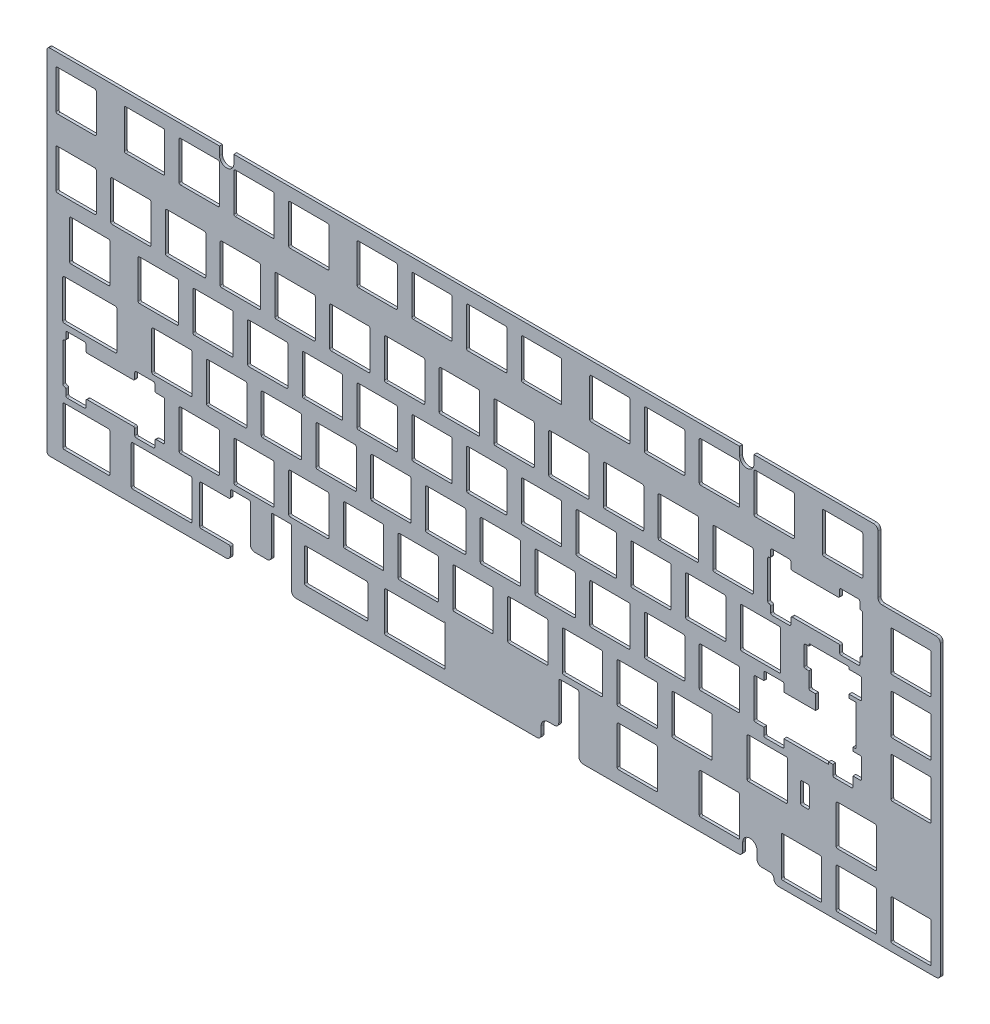
from build123d import *

# Parameters (mm, degrees)
BOSS_EXTRUDE1_DEPTH = 1
CUT_EXTRUDE2_DEPTH  = 1.3
CUT_EXTRUDE1_DEPTH  = 10


with BuildPart() as part:
    # Model → Boss-Extrude1 (new body)
    with BuildSketch(Plane.XY):
        with BuildLine():
            ThreePointArc((9.955298424, 130.969514546), (9.177480965, 130.647332005), (8.855298424, 129.869514546))
            Line((8.855298424, 129.869514546), (8.855298424, 63.082014546))
            Line((8.855298424, 63.082014546), (8.855298424, 9.057014546))
            ThreePointArc((8.855298424, 9.057014546), (9.177480965, 8.279197086), (9.955298424, 7.957014546))
            Line((9.955298424, 7.957014546), (71.206983424, 7.957014546))
            ThreePointArc((71.206983424, 7.957014546), (72.267643596, 8.396354374), (72.706983424, 9.457014546))
            Line((72.706983424, 9.457014546), (72.706983424, 11.957014546))
            ThreePointArc((72.706983424, 11.957014546), (72.560536815, 12.310567936), (72.206983424, 12.457014546))
            Line((72.206983424, 12.457014546), (62.559375038, 12.457014546))
            ThreePointArc((62.559375038, 12.457014546), (62.205821647, 12.603461155), (62.059375038, 12.957014546))
            Line((62.059375038, 12.957014546), (62.059375038, 25.957014546))
            ThreePointArc((62.059375038, 25.957014546), (62.205821647, 26.310567936), (62.559375038, 26.457014546))
            Line((62.559375038, 26.457014546), (72.206983424, 26.457014546))
            ThreePointArc((72.206983424, 26.457014546), (72.560536815, 26.603461155), (72.706983424, 26.957014546))
            Line((72.706983424, 26.957014546), (72.706983424, 28.958014546))
            ThreePointArc((72.706983424, 28.958014546), (72.853430033, 29.311567936), (73.206983424, 29.458014546))
            Line((73.206983424, 29.458014546), (79.206983424, 29.458014546))
            ThreePointArc((79.206983424, 29.458014546), (79.560536815, 29.311567936), (79.706983424, 28.958014546))
            Line((79.706983424, 28.958014546), (79.706983424, 16.157014546))
            ThreePointArc((79.706983424, 16.157014546), (80.146323252, 15.096354374), (81.206983424, 14.657014546))
            Line((81.206983424, 14.657014546), (85.495873424, 14.657014546))
            ThreePointArc((85.495873424, 14.657014546), (86.556533596, 15.096354374), (86.995873424, 16.157014546))
            Line((86.995873424, 16.157014546), (86.995873424, 28.958014546))
            ThreePointArc((86.995873424, 28.958014546), (87.142320033, 29.311567936), (87.495873424, 29.458014546))
            Line((87.495873424, 29.458014546), (93.495873424, 29.458014546))
            ThreePointArc((93.495873424, 29.458014546), (93.849426815, 29.311567936), (93.995873424, 28.958014546))
            Line((93.995873424, 28.958014546), (93.995873424, 9.457014546))
            ThreePointArc((93.995873424, 9.457014546), (94.435213252, 8.396354374), (95.495873424, 7.957014546))
            Line((95.495873424, 7.957014546), (179.362538424, 7.957014546))
            ThreePointArc((179.362538424, 7.957014546), (180.423198596, 8.396354374), (180.862538424, 9.457014546))
            Line((180.862538424, 9.457014546), (180.862538424, 12.157014546))
            ThreePointArc((180.862538424, 12.157014546), (181.594771471, 13.924781498), (183.362538424, 14.657014546))
            Line((183.362538424, 14.657014546), (185.495872282, 14.657014546))
            ThreePointArc((185.495872282, 14.657014546), (186.556532454, 15.096354374), (186.995872282, 16.157014546))
            Line((186.995872282, 16.157014546), (186.995872282, 28.958013975))
            ThreePointArc((186.995872282, 28.958013975), (187.14231869, 29.311567734), (187.495872282, 29.458014546))
            Line((187.495872282, 29.458014546), (193.495873424, 29.458014546))
            ThreePointArc((193.495873424, 29.458014546), (193.849426815, 29.311567936), (193.995873424, 28.958014546))
            Line((193.995873424, 28.958014546), (193.995873424, 9.457014546))
            ThreePointArc((193.995873424, 9.457014546), (194.435213252, 8.396354374), (195.495873424, 7.957014546))
            Line((195.495873424, 7.957014546), (249.492798424, 7.957014546))
            ThreePointArc((249.492798424, 7.957014546), (250.553458596, 8.396354374), (250.992798424, 9.457014546))
            Line((250.992798424, 9.457014546), (250.992798424, 12.157014546))
            ThreePointArc((250.992798424, 12.157014546), (253.492798424, 14.657014546), (255.992798424, 12.157014546))
            Line((255.992798424, 12.157014546), (255.992798424, 9.457014546))
            ThreePointArc((255.992798424, 9.457014546), (256.432138252, 8.396354374), (257.492798424, 7.957014546))
            Line((257.492798424, 7.957014546), (260.370951122, 7.957014546))
            ThreePointArc((260.370951122, 7.957014546), (261.407019411, 7.541709203), (261.869374773, 6.525764546))
            ThreePointArc((261.869374773, 6.525764546), (262.331730135, 5.509819888), (263.367798424, 5.094514546))
            Line((263.367798424, 5.094514546), (318.267798424, 5.094514546))
            ThreePointArc((318.267798424, 5.094514546), (319.328458596, 5.533854374), (319.767798424, 6.594514546))
            Line((319.767798424, 6.594514546), (319.767798424, 63.082014546))
            Line((319.767798424, 63.082014546), (319.767798424, 106.45317864))
            ThreePointArc((319.767798424, 106.45317864), (319.328458596, 107.513838812), (318.267798424, 107.95317864))
            Line((318.267798424, 107.95317864), (299.555298424, 107.95317864))
            ThreePointArc((299.555298424, 107.95317864), (298.494638252, 108.392518468), (298.055298424, 109.45317864))
            Line((298.055298424, 109.45317864), (298.055298424, 129.469514546))
            ThreePointArc((298.055298424, 129.469514546), (297.615958596, 130.530174717), (296.555298424, 130.969514546))
            Line((296.555298424, 130.969514546), (256.426800065, 130.969514546))
            Line((256.426800065, 130.969514546), (248.426800065, 130.969514546))
            Line((248.426800065, 130.969514546), (75.451800065, 130.969514546))
            Line((75.451800065, 130.969514546), (67.451800065, 130.969514546))
            Line((67.451800065, 130.969514546), (9.955298424, 130.969514546))
        make_face()
        with BuildLine():
            ThreePointArc((14.934285038, 12.457014546), (14.580731647, 12.603461155), (14.434285038, 12.957014546))
            Line((14.434285038, 12.957014546), (14.434285038, 25.957014546))
            ThreePointArc((14.434285038, 25.957014546), (14.580731647, 26.310567936), (14.934285038, 26.457014546))
            Line((14.934285038, 26.457014546), (30.319483424, 26.457014546))
            ThreePointArc((30.319483424, 26.457014546), (30.673036815, 26.310567936), (30.819483424, 25.957014546))
            Line((30.819483424, 25.957014546), (30.819483424, 12.957014546))
            ThreePointArc((30.819483424, 12.957014546), (30.673036815, 12.603461155), (30.319483424, 12.457014546))
            Line((30.319483424, 12.457014546), (14.934285038, 12.457014546))
        make_face(mode=Mode.SUBTRACT)
        with BuildLine():
            ThreePointArc((38.745375038, 12.457014546), (38.391821647, 12.603461155), (38.245375038, 12.957014546))
            Line((38.245375038, 12.957014546), (38.245375038, 25.957014546))
            ThreePointArc((38.245375038, 25.957014546), (38.391821647, 26.310567936), (38.745375038, 26.457014546))
            Line((38.745375038, 26.457014546), (58.894483424, 26.457014546))
            ThreePointArc((58.894483424, 26.457014546), (59.248036815, 26.310567936), (59.394483424, 25.957014546))
            Line((59.394483424, 25.957014546), (59.394483424, 12.957014546))
            ThreePointArc((59.394483424, 12.957014546), (59.248036815, 12.603461155), (58.894483424, 12.457014546))
            Line((58.894483424, 12.457014546), (38.745375038, 12.457014546))
        make_face(mode=Mode.SUBTRACT)
        with BuildLine():
            Line((120.541283424, 24.957014546), (120.541283424, 13.957014546))
            ThreePointArc((120.541283424, 13.957014546), (120.394836815, 13.603461155), (120.041283424, 13.457014546))
            Line((120.041283424, 13.457014546), (99.041283424, 13.457014546))
            ThreePointArc((99.041283424, 13.457014546), (98.687730033, 13.603461155), (98.541283424, 13.957014546))
            Line((98.541283424, 13.957014546), (98.541283424, 24.957014546))
            ThreePointArc((98.541283424, 24.957014546), (98.687730033, 25.310567936), (99.041283424, 25.457014546))
            Line((99.041283424, 25.457014546), (120.041283424, 25.457014546))
            ThreePointArc((120.041283424, 25.457014546), (120.394836815, 25.310567936), (120.541283424, 24.957014546))
        make_face(mode=Mode.SUBTRACT)
        with BuildLine():
            ThreePointArc((126.856983424, 12.457014546), (126.503430033, 12.603461155), (126.356983424, 12.957014546))
            Line((126.356983424, 12.957014546), (126.356983424, 25.957014546))
            ThreePointArc((126.356983424, 25.957014546), (126.503430033, 26.310567936), (126.856983424, 26.457014546))
            Line((126.856983424, 26.457014546), (146.995875038, 26.457014546))
            ThreePointArc((146.995875038, 26.457014546), (147.192055678, 26.702383251), (147.495875038, 26.782298463))
            Line((147.495875038, 26.782298463), (147.495875038, 12.957014546))
            ThreePointArc((147.495875038, 12.957014546), (147.349428429, 12.603461155), (146.995875038, 12.457014546))
            Line((146.995875038, 12.457014546), (126.856983424, 12.457014546))
        make_face(mode=Mode.SUBTRACT)
        with BuildLine():
            Line((15.463233424, 46.007014546), (15.463233424, 48.007314546))
            ThreePointArc((15.463233424, 48.007314546), (15.609680033, 48.360867936), (15.963233424, 48.507314546))
            Line((15.963233424, 48.507314546), (21.963233424, 48.507314546))
            ThreePointArc((21.963233424, 48.507314546), (22.316786815, 48.360867936), (22.463233424, 48.007314546))
            Line((22.463233424, 48.007314546), (22.463233424, 46.007314546))
            ThreePointArc((22.463233424, 46.007314546), (22.609680033, 45.653761155), (22.963233424, 45.507314546))
            Line((22.963233424, 45.507314546), (38.963233424, 45.507314546))
            ThreePointArc((38.963233424, 45.507314546), (39.316786815, 45.653761155), (39.463233424, 46.007314546))
            Line((39.463233424, 46.007314546), (39.463233424, 48.007314546))
            ThreePointArc((39.463233424, 48.007314546), (39.609680033, 48.360867936), (39.963233424, 48.507314546))
            Line((39.963233424, 48.507314546), (45.963233424, 48.507314546))
            ThreePointArc((45.963233424, 48.507314546), (46.316786815, 48.360867936), (46.463233424, 48.007314546))
            Line((46.463233424, 48.007314546), (46.463233424, 46.007014546))
            ThreePointArc((46.463233424, 46.007014546), (46.609680033, 45.653461155), (46.963233424, 45.507014546))
            Line((46.963233424, 45.507014546), (49.367798424, 45.507014546))
            ThreePointArc((49.367798424, 45.507014546), (49.721351815, 45.360567936), (49.867798424, 45.007014546))
            Line((49.867798424, 45.007014546), (49.867798424, 32.007014546))
            ThreePointArc((49.867798424, 32.007014546), (49.721351815, 31.653461155), (49.367798424, 31.507014546))
            Line((49.367798424, 31.507014546), (46.963233424, 31.507014546))
            ThreePointArc((46.963233424, 31.507014546), (46.609680033, 31.360567936), (46.463233424, 31.007014546))
            Line((46.463233424, 31.007014546), (46.463233424, 29.007314546))
            ThreePointArc((46.463233424, 29.007314546), (46.316786815, 28.653761155), (45.963233424, 28.507314546))
            Line((45.963233424, 28.507314546), (39.963233424, 28.507314546))
            ThreePointArc((39.963233424, 28.507314546), (39.609680033, 28.653761155), (39.463233424, 29.007314546))
            Line((39.463233424, 29.007314546), (39.463233424, 31.007314546))
            ThreePointArc((39.463233424, 31.007314546), (39.316786815, 31.360867936), (38.963233424, 31.507314546))
            Line((38.963233424, 31.507314546), (22.963233424, 31.507314546))
            ThreePointArc((22.963233424, 31.507314546), (22.609680033, 31.360867936), (22.463233424, 31.007314546))
            Line((22.463233424, 31.007314546), (22.463233424, 29.007314546))
            ThreePointArc((22.463233424, 29.007314546), (22.316786815, 28.653761155), (21.963233424, 28.507314546))
            Line((21.963233424, 28.507314546), (15.963233424, 28.507314546))
            ThreePointArc((15.963233424, 28.507314546), (15.609680033, 28.653761155), (15.463233424, 29.007314546))
            Line((15.463233424, 29.007314546), (15.463233424, 31.007014546))
            ThreePointArc((15.463233424, 31.007014546), (15.316786815, 31.360567936), (14.963233424, 31.507014546))
            Line((14.963233424, 31.507014546), (14.936548424, 31.507014546))
            ThreePointArc((14.936548424, 31.507014546), (14.582995033, 31.653461155), (14.436548424, 32.007014546))
            Line((14.436548424, 32.007014546), (14.436548424, 45.007014546))
            ThreePointArc((14.436548424, 45.007014546), (14.582995033, 45.360567936), (14.936548424, 45.507014546))
            Line((14.936548424, 45.507014546), (14.963233424, 45.507014546))
            ThreePointArc((14.963233424, 45.507014546), (15.316786815, 45.653461155), (15.463233424, 46.007014546))
        make_face(mode=Mode.SUBTRACT)
        with BuildLine():
            Line((68.442798424, 31.482014546), (55.392798424, 31.482014546))
            ThreePointArc((55.392798424, 31.482014546), (55.039245033, 31.628461155), (54.892798424, 31.982014546))
            Line((54.892798424, 31.982014546), (54.892798424, 45.032014546))
            ThreePointArc((54.892798424, 45.032014546), (55.039245033, 45.385567936), (55.392798424, 45.532014546))
            Line((55.392798424, 45.532014546), (68.442798424, 45.532014546))
            ThreePointArc((68.442798424, 45.532014546), (68.796351815, 45.385567936), (68.942798424, 45.032014546))
            Line((68.942798424, 45.032014546), (68.942798424, 31.982014546))
            ThreePointArc((68.942798424, 31.982014546), (68.796351815, 31.628461155), (68.442798424, 31.482014546))
        make_face(mode=Mode.SUBTRACT)
        with BuildLine():
            Line((87.492798424, 31.482014546), (74.442798424, 31.482014546))
            ThreePointArc((74.442798424, 31.482014546), (74.089245033, 31.628461155), (73.942798424, 31.982014546))
            Line((73.942798424, 31.982014546), (73.942798424, 45.032014546))
            ThreePointArc((73.942798424, 45.032014546), (74.089245033, 45.385567936), (74.442798424, 45.532014546))
            Line((74.442798424, 45.532014546), (87.492798424, 45.532014546))
            ThreePointArc((87.492798424, 45.532014546), (87.846351815, 45.385567936), (87.992798424, 45.032014546))
            Line((87.992798424, 45.032014546), (87.992798424, 31.982014546))
            ThreePointArc((87.992798424, 31.982014546), (87.846351815, 31.628461155), (87.492798424, 31.482014546))
        make_face(mode=Mode.SUBTRACT)
        with BuildLine():
            ThreePointArc((33.249048424, 51.057014546), (33.087957154, 50.668105816), (32.699048424, 50.507014546))
            Line((32.699048424, 50.507014546), (14.936548424, 50.507014546))
            ThreePointArc((14.936548424, 50.507014546), (14.547639694, 50.668105816), (14.386548424, 51.057014546))
            Line((14.386548424, 51.057014546), (14.386548424, 64.057014546))
            ThreePointArc((14.386548424, 64.057014546), (14.547639694, 64.445923275), (14.936548424, 64.607014546))
            Line((14.936548424, 64.607014546), (32.699048424, 64.607014546))
            ThreePointArc((32.699048424, 64.607014546), (33.087957154, 64.445923275), (33.249048424, 64.057014546))
            Line((33.249048424, 64.057014546), (33.249048424, 51.057014546))
        make_face(mode=Mode.SUBTRACT)
        with BuildLine():
            Line((58.917798424, 50.532014546), (45.867798424, 50.532014546))
            ThreePointArc((45.867798424, 50.532014546), (45.514245033, 50.678461155), (45.367798424, 51.032014546))
            Line((45.367798424, 51.032014546), (45.367798424, 64.082014546))
            ThreePointArc((45.367798424, 64.082014546), (45.514245033, 64.435567936), (45.867798424, 64.582014546))
            Line((45.867798424, 64.582014546), (58.917798424, 64.582014546))
            ThreePointArc((58.917798424, 64.582014546), (59.271351815, 64.435567936), (59.417798424, 64.082014546))
            Line((59.417798424, 64.082014546), (59.417798424, 51.032014546))
            ThreePointArc((59.417798424, 51.032014546), (59.271351815, 50.678461155), (58.917798424, 50.532014546))
        make_face(mode=Mode.SUBTRACT)
        with BuildLine():
            Line((77.967798424, 50.532014546), (64.917798424, 50.532014546))
            ThreePointArc((64.917798424, 50.532014546), (64.564245033, 50.678461155), (64.417798424, 51.032014546))
            Line((64.417798424, 51.032014546), (64.417798424, 64.082014546))
            ThreePointArc((64.417798424, 64.082014546), (64.564245033, 64.435567936), (64.917798424, 64.582014546))
            Line((64.917798424, 64.582014546), (77.967798424, 64.582014546))
            ThreePointArc((77.967798424, 64.582014546), (78.321351815, 64.435567936), (78.467798424, 64.082014546))
            Line((78.467798424, 64.082014546), (78.467798424, 51.032014546))
            ThreePointArc((78.467798424, 51.032014546), (78.321351815, 50.678461155), (77.967798424, 50.532014546))
        make_face(mode=Mode.SUBTRACT)
        with BuildLine():
            Line((106.542798424, 31.482014546), (93.492798424, 31.482014546))
            ThreePointArc((93.492798424, 31.482014546), (93.139245033, 31.628461155), (92.992798424, 31.982014546))
            Line((92.992798424, 31.982014546), (92.992798424, 45.032014546))
            ThreePointArc((92.992798424, 45.032014546), (93.139245033, 45.385567936), (93.492798424, 45.532014546))
            Line((93.492798424, 45.532014546), (106.542798424, 45.532014546))
            ThreePointArc((106.542798424, 45.532014546), (106.896351815, 45.385567936), (107.042798424, 45.032014546))
            Line((107.042798424, 45.032014546), (107.042798424, 31.982014546))
            ThreePointArc((107.042798424, 31.982014546), (106.896351815, 31.628461155), (106.542798424, 31.482014546))
        make_face(mode=Mode.SUBTRACT)
        with BuildLine():
            Line((125.592798424, 31.482014546), (112.542798424, 31.482014546))
            ThreePointArc((112.542798424, 31.482014546), (112.189245033, 31.628461155), (112.042798424, 31.982014546))
            Line((112.042798424, 31.982014546), (112.042798424, 45.032014546))
            ThreePointArc((112.042798424, 45.032014546), (112.189245033, 45.385567936), (112.542798424, 45.532014546))
            Line((112.542798424, 45.532014546), (125.592798424, 45.532014546))
            ThreePointArc((125.592798424, 45.532014546), (125.946351815, 45.385567936), (126.092798424, 45.032014546))
            Line((126.092798424, 45.032014546), (126.092798424, 31.982014546))
            ThreePointArc((126.092798424, 31.982014546), (125.946351815, 31.628461155), (125.592798424, 31.482014546))
        make_face(mode=Mode.SUBTRACT)
        with BuildLine():
            Line((144.642798424, 31.482014546), (131.592798424, 31.482014546))
            ThreePointArc((131.592798424, 31.482014546), (131.239245033, 31.628461155), (131.092798424, 31.982014546))
            Line((131.092798424, 31.982014546), (131.092798424, 45.032014546))
            ThreePointArc((131.092798424, 45.032014546), (131.239245033, 45.385567936), (131.592798424, 45.532014546))
            Line((131.592798424, 45.532014546), (144.642798424, 45.532014546))
            ThreePointArc((144.642798424, 45.532014546), (144.996351815, 45.385567936), (145.142798424, 45.032014546))
            Line((145.142798424, 45.032014546), (145.142798424, 31.982014546))
            ThreePointArc((145.142798424, 31.982014546), (144.996351815, 31.628461155), (144.642798424, 31.482014546))
        make_face(mode=Mode.SUBTRACT)
        with BuildLine():
            Line((163.692798424, 31.482014546), (150.642798424, 31.482014546))
            ThreePointArc((150.642798424, 31.482014546), (150.289245033, 31.628461155), (150.142798424, 31.982014546))
            Line((150.142798424, 31.982014546), (150.142798424, 45.032014546))
            ThreePointArc((150.142798424, 45.032014546), (150.289245033, 45.385567936), (150.642798424, 45.532014546))
            Line((150.642798424, 45.532014546), (163.692798424, 45.532014546))
            ThreePointArc((163.692798424, 45.532014546), (164.046351815, 45.385567936), (164.192798424, 45.032014546))
            Line((164.192798424, 45.032014546), (164.192798424, 31.982014546))
            ThreePointArc((164.192798424, 31.982014546), (164.046351815, 31.628461155), (163.692798424, 31.482014546))
        make_face(mode=Mode.SUBTRACT)
        with BuildLine():
            Line((97.017798424, 50.532014546), (83.967798424, 50.532014546))
            ThreePointArc((83.967798424, 50.532014546), (83.614245033, 50.678461155), (83.467798424, 51.032014546))
            Line((83.467798424, 51.032014546), (83.467798424, 64.082014546))
            ThreePointArc((83.467798424, 64.082014546), (83.614245033, 64.435567936), (83.967798424, 64.582014546))
            Line((83.967798424, 64.582014546), (97.017798424, 64.582014546))
            ThreePointArc((97.017798424, 64.582014546), (97.371351815, 64.435567936), (97.517798424, 64.082014546))
            Line((97.517798424, 64.082014546), (97.517798424, 51.032014546))
            ThreePointArc((97.517798424, 51.032014546), (97.371351815, 50.678461155), (97.017798424, 50.532014546))
        make_face(mode=Mode.SUBTRACT)
        with BuildLine():
            Line((116.067798424, 50.532014546), (103.017798424, 50.532014546))
            ThreePointArc((103.017798424, 50.532014546), (102.664245033, 50.678461155), (102.517798424, 51.032014546))
            Line((102.517798424, 51.032014546), (102.517798424, 64.082014546))
            ThreePointArc((102.517798424, 64.082014546), (102.664245033, 64.435567936), (103.017798424, 64.582014546))
            Line((103.017798424, 64.582014546), (116.067798424, 64.582014546))
            ThreePointArc((116.067798424, 64.582014546), (116.421351815, 64.435567936), (116.567798424, 64.082014546))
            Line((116.567798424, 64.082014546), (116.567798424, 51.032014546))
            ThreePointArc((116.567798424, 51.032014546), (116.421351815, 50.678461155), (116.067798424, 50.532014546))
        make_face(mode=Mode.SUBTRACT)
        with BuildLine():
            Line((135.117798424, 50.532014546), (122.067798424, 50.532014546))
            ThreePointArc((122.067798424, 50.532014546), (121.714245033, 50.678461155), (121.567798424, 51.032014546))
            Line((121.567798424, 51.032014546), (121.567798424, 64.082014546))
            ThreePointArc((121.567798424, 64.082014546), (121.714245033, 64.435567936), (122.067798424, 64.582014546))
            Line((122.067798424, 64.582014546), (135.117798424, 64.582014546))
            ThreePointArc((135.117798424, 64.582014546), (135.471351815, 64.435567936), (135.617798424, 64.082014546))
            Line((135.617798424, 64.082014546), (135.617798424, 51.032014546))
            ThreePointArc((135.617798424, 51.032014546), (135.471351815, 50.678461155), (135.117798424, 50.532014546))
        make_face(mode=Mode.SUBTRACT)
        with BuildLine():
            Line((154.167798424, 50.532014546), (141.117798424, 50.532014546))
            ThreePointArc((141.117798424, 50.532014546), (140.764245033, 50.678461155), (140.617798424, 51.032014546))
            Line((140.617798424, 51.032014546), (140.617798424, 64.082014546))
            ThreePointArc((140.617798424, 64.082014546), (140.764245033, 64.435567936), (141.117798424, 64.582014546))
            Line((141.117798424, 64.582014546), (154.167798424, 64.582014546))
            ThreePointArc((154.167798424, 64.582014546), (154.521351815, 64.435567936), (154.667798424, 64.082014546))
            Line((154.667798424, 64.082014546), (154.667798424, 51.032014546))
            ThreePointArc((154.667798424, 51.032014546), (154.521351815, 50.678461155), (154.167798424, 50.532014546))
        make_face(mode=Mode.SUBTRACT)
        with BuildLine():
            Line((220.842798424, 12.432014546), (207.792798424, 12.432014546))
            ThreePointArc((207.792798424, 12.432014546), (207.439245033, 12.578461155), (207.292798424, 12.932014546))
            Line((207.292798424, 12.932014546), (207.292798424, 25.982014546))
            ThreePointArc((207.292798424, 25.982014546), (207.439245033, 26.335567936), (207.792798424, 26.482014546))
            Line((207.792798424, 26.482014546), (220.842798424, 26.482014546))
            ThreePointArc((220.842798424, 26.482014546), (221.196351815, 26.335567936), (221.342798424, 25.982014546))
            Line((221.342798424, 25.982014546), (221.342798424, 12.932014546))
            ThreePointArc((221.342798424, 12.932014546), (221.196351815, 12.578461155), (220.842798424, 12.432014546))
        make_face(mode=Mode.SUBTRACT)
        with BuildLine():
            Line((249.417798424, 12.432014546), (236.367798424, 12.432014546))
            ThreePointArc((236.367798424, 12.432014546), (236.014245033, 12.578461155), (235.867798424, 12.932014546))
            Line((235.867798424, 12.932014546), (235.867798424, 25.982014546))
            ThreePointArc((235.867798424, 25.982014546), (236.014245033, 26.335567936), (236.367798424, 26.482014546))
            Line((236.367798424, 26.482014546), (249.417798424, 26.482014546))
            ThreePointArc((249.417798424, 26.482014546), (249.771351815, 26.335567936), (249.917798424, 25.982014546))
            Line((249.917798424, 25.982014546), (249.917798424, 12.932014546))
            ThreePointArc((249.917798424, 12.932014546), (249.771351815, 12.578461155), (249.417798424, 12.432014546))
        make_face(mode=Mode.SUBTRACT)
        with BuildLine():
            Line((277.992798424, 7.669514546), (264.942798424, 7.669514546))
            ThreePointArc((264.942798424, 7.669514546), (264.589245033, 7.815961155), (264.442798424, 8.169514546))
            Line((264.442798424, 8.169514546), (264.442798424, 21.219514546))
            ThreePointArc((264.442798424, 21.219514546), (264.589245033, 21.573067936), (264.942798424, 21.719514546))
            Line((264.942798424, 21.719514546), (277.992798424, 21.719514546))
            ThreePointArc((277.992798424, 21.719514546), (278.346351815, 21.573067936), (278.492798424, 21.219514546))
            Line((278.492798424, 21.219514546), (278.492798424, 8.169514546))
            ThreePointArc((278.492798424, 8.169514546), (278.346351815, 7.815961155), (277.992798424, 7.669514546))
        make_face(mode=Mode.SUBTRACT)
        with BuildLine():
            Line((297.042798424, 7.669514546), (283.992798424, 7.669514546))
            ThreePointArc((283.992798424, 7.669514546), (283.639245033, 7.815961155), (283.492798424, 8.169514546))
            Line((283.492798424, 8.169514546), (283.492798424, 21.219514546))
            ThreePointArc((283.492798424, 21.219514546), (283.639245033, 21.573067936), (283.992798424, 21.719514546))
            Line((283.992798424, 21.719514546), (297.042798424, 21.719514546))
            ThreePointArc((297.042798424, 21.719514546), (297.396351815, 21.573067936), (297.542798424, 21.219514546))
            Line((297.542798424, 21.219514546), (297.542798424, 8.169514546))
            ThreePointArc((297.542798424, 8.169514546), (297.396351815, 7.815961155), (297.042798424, 7.669514546))
        make_face(mode=Mode.SUBTRACT)
        with BuildLine():
            Line((316.092798424, 7.669514546), (303.042798424, 7.669514546))
            ThreePointArc((303.042798424, 7.669514546), (302.689245033, 7.815961155), (302.542798424, 8.169514546))
            Line((302.542798424, 8.169514546), (302.542798424, 21.219514546))
            ThreePointArc((302.542798424, 21.219514546), (302.689245033, 21.573067936), (303.042798424, 21.719514546))
            Line((303.042798424, 21.719514546), (316.092798424, 21.719514546))
            ThreePointArc((316.092798424, 21.719514546), (316.446351815, 21.573067936), (316.592798424, 21.219514546))
            Line((316.592798424, 21.219514546), (316.592798424, 8.169514546))
            ThreePointArc((316.592798424, 8.169514546), (316.446351815, 7.815961155), (316.092798424, 7.669514546))
        make_face(mode=Mode.SUBTRACT)
        with BuildLine():
            Line((297.042798424, 26.719514546), (283.992798424, 26.719514546))
            ThreePointArc((283.992798424, 26.719514546), (283.639245033, 26.865961155), (283.492798424, 27.219514546))
            Line((283.492798424, 27.219514546), (283.492798424, 40.269514546))
            ThreePointArc((283.492798424, 40.269514546), (283.639245033, 40.623067936), (283.992798424, 40.769514546))
            Line((283.992798424, 40.769514546), (297.042798424, 40.769514546))
            ThreePointArc((297.042798424, 40.769514546), (297.396351815, 40.623067936), (297.542798424, 40.269514546))
            Line((297.542798424, 40.269514546), (297.542798424, 27.219514546))
            ThreePointArc((297.542798424, 27.219514546), (297.396351815, 26.865961155), (297.042798424, 26.719514546))
        make_face(mode=Mode.SUBTRACT)
        with BuildLine():
            Line((182.742798424, 31.482014546), (169.692798424, 31.482014546))
            ThreePointArc((169.692798424, 31.482014546), (169.339245033, 31.628461155), (169.192798424, 31.982014546))
            Line((169.192798424, 31.982014546), (169.192798424, 45.032014546))
            ThreePointArc((169.192798424, 45.032014546), (169.339245033, 45.385567936), (169.692798424, 45.532014546))
            Line((169.692798424, 45.532014546), (182.742798424, 45.532014546))
            ThreePointArc((182.742798424, 45.532014546), (183.096351815, 45.385567936), (183.242798424, 45.032014546))
            Line((183.242798424, 45.032014546), (183.242798424, 31.982014546))
            ThreePointArc((183.242798424, 31.982014546), (183.096351815, 31.628461155), (182.742798424, 31.482014546))
        make_face(mode=Mode.SUBTRACT)
        with BuildLine():
            Line((201.792798424, 31.482014546), (188.742798424, 31.482014546))
            ThreePointArc((188.742798424, 31.482014546), (188.389245033, 31.628461155), (188.242798424, 31.982014546))
            Line((188.242798424, 31.982014546), (188.242798424, 45.032014546))
            ThreePointArc((188.242798424, 45.032014546), (188.389245033, 45.385567936), (188.742798424, 45.532014546))
            Line((188.742798424, 45.532014546), (201.792798424, 45.532014546))
            ThreePointArc((201.792798424, 45.532014546), (202.146351815, 45.385567936), (202.292798424, 45.032014546))
            Line((202.292798424, 45.032014546), (202.292798424, 31.982014546))
            ThreePointArc((202.292798424, 31.982014546), (202.146351815, 31.628461155), (201.792798424, 31.482014546))
        make_face(mode=Mode.SUBTRACT)
        with BuildLine():
            Line((220.842798424, 31.482014546), (207.792798424, 31.482014546))
            ThreePointArc((207.792798424, 31.482014546), (207.439245033, 31.628461155), (207.292798424, 31.982014546))
            Line((207.292798424, 31.982014546), (207.292798424, 45.032014546))
            ThreePointArc((207.292798424, 45.032014546), (207.439245033, 45.385567936), (207.792798424, 45.532014546))
            Line((207.792798424, 45.532014546), (220.842798424, 45.532014546))
            ThreePointArc((220.842798424, 45.532014546), (221.196351815, 45.385567936), (221.342798424, 45.032014546))
            Line((221.342798424, 45.032014546), (221.342798424, 31.982014546))
            ThreePointArc((221.342798424, 31.982014546), (221.196351815, 31.628461155), (220.842798424, 31.482014546))
        make_face(mode=Mode.SUBTRACT)
        with BuildLine():
            Line((239.892798424, 31.482014546), (226.842798424, 31.482014546))
            ThreePointArc((226.842798424, 31.482014546), (226.489245033, 31.628461155), (226.342798424, 31.982014546))
            Line((226.342798424, 31.982014546), (226.342798424, 45.032014546))
            ThreePointArc((226.342798424, 45.032014546), (226.489245033, 45.385567936), (226.842798424, 45.532014546))
            Line((226.842798424, 45.532014546), (239.892798424, 45.532014546))
            ThreePointArc((239.892798424, 45.532014546), (240.246351815, 45.385567936), (240.392798424, 45.032014546))
            Line((240.392798424, 45.032014546), (240.392798424, 31.982014546))
            ThreePointArc((240.392798424, 31.982014546), (240.246351815, 31.628461155), (239.892798424, 31.482014546))
        make_face(mode=Mode.SUBTRACT)
        with BuildLine():
            Line((173.217798424, 50.532014546), (160.167798424, 50.532014546))
            ThreePointArc((160.167798424, 50.532014546), (159.814245033, 50.678461155), (159.667798424, 51.032014546))
            Line((159.667798424, 51.032014546), (159.667798424, 64.082014546))
            ThreePointArc((159.667798424, 64.082014546), (159.814245033, 64.435567936), (160.167798424, 64.582014546))
            Line((160.167798424, 64.582014546), (173.217798424, 64.582014546))
            ThreePointArc((173.217798424, 64.582014546), (173.571351815, 64.435567936), (173.717798424, 64.082014546))
            Line((173.717798424, 64.082014546), (173.717798424, 51.032014546))
            ThreePointArc((173.717798424, 51.032014546), (173.571351815, 50.678461155), (173.217798424, 50.532014546))
        make_face(mode=Mode.SUBTRACT)
        with BuildLine():
            Line((192.267798424, 50.532014546), (179.217798424, 50.532014546))
            ThreePointArc((179.217798424, 50.532014546), (178.864245033, 50.678461155), (178.717798424, 51.032014546))
            Line((178.717798424, 51.032014546), (178.717798424, 64.082014546))
            ThreePointArc((178.717798424, 64.082014546), (178.864245033, 64.435567936), (179.217798424, 64.582014546))
            Line((179.217798424, 64.582014546), (192.267798424, 64.582014546))
            ThreePointArc((192.267798424, 64.582014546), (192.621351815, 64.435567936), (192.767798424, 64.082014546))
            Line((192.767798424, 64.082014546), (192.767798424, 51.032014546))
            ThreePointArc((192.767798424, 51.032014546), (192.621351815, 50.678461155), (192.267798424, 50.532014546))
        make_face(mode=Mode.SUBTRACT)
        with BuildLine():
            Line((211.317798424, 50.532014546), (198.267798424, 50.532014546))
            ThreePointArc((198.267798424, 50.532014546), (197.914245033, 50.678461155), (197.767798424, 51.032014546))
            Line((197.767798424, 51.032014546), (197.767798424, 64.082014546))
            ThreePointArc((197.767798424, 64.082014546), (197.914245033, 64.435567936), (198.267798424, 64.582014546))
            Line((198.267798424, 64.582014546), (211.317798424, 64.582014546))
            ThreePointArc((211.317798424, 64.582014546), (211.671351815, 64.435567936), (211.817798424, 64.082014546))
            Line((211.817798424, 64.082014546), (211.817798424, 51.032014546))
            ThreePointArc((211.817798424, 51.032014546), (211.671351815, 50.678461155), (211.317798424, 50.532014546))
        make_face(mode=Mode.SUBTRACT)
        with BuildLine():
            Line((230.367798424, 50.532014546), (217.317798424, 50.532014546))
            ThreePointArc((217.317798424, 50.532014546), (216.964245033, 50.678461155), (216.817798424, 51.032014546))
            Line((216.817798424, 51.032014546), (216.817798424, 64.082014546))
            ThreePointArc((216.817798424, 64.082014546), (216.964245033, 64.435567936), (217.317798424, 64.582014546))
            Line((217.317798424, 64.582014546), (230.367798424, 64.582014546))
            ThreePointArc((230.367798424, 64.582014546), (230.721351815, 64.435567936), (230.867798424, 64.082014546))
            Line((230.867798424, 64.082014546), (230.867798424, 51.032014546))
            ThreePointArc((230.867798424, 51.032014546), (230.721351815, 50.678461155), (230.367798424, 50.532014546))
        make_face(mode=Mode.SUBTRACT)
        with BuildLine():
            Line((266.086548424, 31.482014546), (253.036548424, 31.482014546))
            ThreePointArc((253.036548424, 31.482014546), (252.682995033, 31.628461155), (252.536548424, 31.982014546))
            Line((252.536548424, 31.982014546), (252.536548424, 45.032014546))
            ThreePointArc((252.536548424, 45.032014546), (252.682995033, 45.385567936), (253.036548424, 45.532014546))
            Line((253.036548424, 45.532014546), (266.086548424, 45.532014546))
            ThreePointArc((266.086548424, 45.532014546), (266.440101815, 45.385567936), (266.586548424, 45.032014546))
            Line((266.586548424, 45.032014546), (266.586548424, 31.982014546))
            ThreePointArc((266.586548424, 31.982014546), (266.440101815, 31.628461155), (266.086548424, 31.482014546))
        make_face(mode=Mode.SUBTRACT)
        with BuildLine():
            ThreePointArc((271.157173424, 40.507014546), (271.303620033, 40.860567936), (271.657173424, 41.007014546))
            Line((271.657173424, 41.007014546), (273.657173424, 41.007014546))
            ThreePointArc((273.657173424, 41.007014546), (274.010726815, 40.860567936), (274.157173424, 40.507014546))
            Line((274.157173424, 40.507014546), (274.157173424, 36.507014546))
            ThreePointArc((274.157173424, 36.507014546), (274.010726815, 36.153461155), (273.657173424, 36.007014546))
            Line((273.657173424, 36.007014546), (271.657173424, 36.007014546))
            ThreePointArc((271.657173424, 36.007014546), (271.303620033, 36.153461155), (271.157173424, 36.507014546))
            Line((271.157173424, 36.507014546), (271.157173424, 40.507014546))
        make_face(mode=Mode.SUBTRACT)
        with BuildLine():
            Line((249.417798424, 50.532014546), (236.367798424, 50.532014546))
            ThreePointArc((236.367798424, 50.532014546), (236.014245033, 50.678461155), (235.867798424, 51.032014546))
            Line((235.867798424, 51.032014546), (235.867798424, 64.082014546))
            ThreePointArc((235.867798424, 64.082014546), (236.014245033, 64.435567936), (236.367798424, 64.582014546))
            Line((236.367798424, 64.582014546), (249.417798424, 64.582014546))
            ThreePointArc((249.417798424, 64.582014546), (249.771351815, 64.435567936), (249.917798424, 64.082014546))
            Line((249.917798424, 64.082014546), (249.917798424, 51.032014546))
            ThreePointArc((249.917798424, 51.032014546), (249.771351815, 50.678461155), (249.417798424, 50.532014546))
        make_face(mode=Mode.SUBTRACT)
        with BuildLine():
            ThreePointArc((273.992798424, 83.107014546), (274.139245033, 83.460567936), (274.492798424, 83.607014546))
            Line((274.492798424, 83.607014546), (287.492798424, 83.607014546))
            ThreePointArc((287.492798424, 83.607014546), (287.846351815, 83.460567936), (287.992798424, 83.107014546))
            Line((287.992798424, 83.107014546), (287.995298424, 82.780068193))
            Line((287.995298424, 82.780068193), (291.850783424, 82.780068193))
            ThreePointArc((291.850783424, 82.780068193), (292.204336815, 82.633621584), (292.350783424, 82.280068193))
            Line((292.350783424, 82.280068193), (292.350783424, 75.842068193))
            ThreePointArc((292.350783424, 75.842068193), (292.204336815, 75.488514803), (291.850783424, 75.342068193))
            Line((291.850783424, 75.342068193), (287.995298424, 75.342068193))
            Line((287.995298424, 75.342068193), (287.995298424, 74.061068193))
            Line((287.995298424, 74.061068193), (290.376548424, 74.061068193))
            Line((290.376548424, 74.061068193), (290.376548424, 60.061068193))
            Line((290.376548424, 60.061068193), (289.350783424, 60.061068193))
            Line((289.350783424, 60.061068193), (289.350783424, 58.780068193))
            Line((289.350783424, 58.780068193), (291.850783424, 58.780068193))
            ThreePointArc((291.850783424, 58.780068193), (292.204336815, 58.633621584), (292.350783424, 58.280068193))
            Line((292.350783424, 58.280068193), (292.350783424, 51.842068193))
            ThreePointArc((292.350783424, 51.842068193), (292.204336815, 51.488514803), (291.850783424, 51.342068193))
            Line((291.850783424, 51.342068193), (289.350783424, 51.342068193))
            Line((289.350783424, 51.342068193), (289.350783424, 48.057014546))
            ThreePointArc((289.350783424, 48.057014546), (289.204336815, 47.703461155), (288.850783424, 47.557014546))
            Line((288.850783424, 47.557014546), (282.850783424, 47.557014546))
            ThreePointArc((282.850783424, 47.557014546), (282.497230033, 47.703461155), (282.350783424, 48.057014546))
            Line((282.350783424, 48.057014546), (282.350783424, 51.342068193))
            Line((282.350783424, 51.342068193), (280.851598424, 51.342068193))
            Line((280.851598424, 51.342068193), (280.851598424, 50.557014546))
            Line((280.851598424, 50.557014546), (265.350783424, 50.557014546))
            Line((265.350783424, 50.557014546), (265.350783424, 48.057014546))
            ThreePointArc((265.350783424, 48.057014546), (265.204336815, 47.703461155), (264.850783424, 47.557014546))
            Line((264.850783424, 47.557014546), (258.850783424, 47.557014546))
            ThreePointArc((258.850783424, 47.557014546), (258.497230033, 47.703461155), (258.350783424, 48.057014546))
            Line((258.350783424, 48.057014546), (258.350783424, 50.557014546))
            Line((258.350783424, 50.557014546), (255.445298424, 50.557014546))
            ThreePointArc((255.445298424, 50.557014546), (255.091745033, 50.703461155), (254.945298424, 51.057014546))
            Line((254.945298424, 51.057014546), (254.945298424, 64.057014546))
            ThreePointArc((254.945298424, 64.057014546), (255.091745033, 64.410567936), (255.445298424, 64.557014546))
            Line((255.445298424, 64.557014546), (258.350783424, 64.557014546))
            Line((258.350783424, 64.557014546), (258.350783424, 67.057014546))
            ThreePointArc((258.350783424, 67.057014546), (258.497230033, 67.410567936), (258.850783424, 67.557014546))
            Line((258.850783424, 67.557014546), (264.850783424, 67.557014546))
            ThreePointArc((264.850783424, 67.557014546), (265.204336815, 67.410567936), (265.350783424, 67.057014546))
            Line((265.350783424, 67.057014546), (265.350783424, 64.557014546))
            Line((265.350783424, 64.557014546), (276.376548424, 64.557014546))
            Line((276.376548424, 64.557014546), (276.376548424, 69.607014546))
            Line((276.376548424, 69.607014546), (274.492798424, 69.607014546))
            ThreePointArc((274.492798424, 69.607014546), (274.139245033, 69.753461155), (273.992798424, 70.107014546))
            Line((273.992798424, 70.107014546), (273.992798424, 75.342068193))
            Line((273.992798424, 75.342068193), (272.850783424, 75.342068193))
            ThreePointArc((272.850783424, 75.342068193), (272.497230033, 75.488514803), (272.350783424, 75.842068193))
            Line((272.350783424, 75.842068193), (272.350783424, 82.280068193))
            ThreePointArc((272.350783424, 82.280068193), (272.497230033, 82.633621584), (272.850783424, 82.780068193))
            Line((272.850783424, 82.780068193), (273.992798424, 82.780068193))
            Line((273.992798424, 82.780068193), (273.992798424, 83.107014546))
        make_face(mode=Mode.SUBTRACT)
        with BuildLine():
            ThreePointArc((302.542798424, 64.057014546), (302.696567364, 64.428245606), (303.067798424, 64.582014546))
            Line((303.067798424, 64.582014546), (316.117798424, 64.582014546))
            ThreePointArc((316.117798424, 64.582014546), (316.453674145, 64.442890267), (316.592798424, 64.107014546))
            Line((316.592798424, 64.107014546), (316.592798424, 51.057014546))
            ThreePointArc((316.592798424, 51.057014546), (316.439029484, 50.685783485), (316.067798424, 50.532014546))
            Line((316.067798424, 50.532014546), (303.067798424, 50.532014546))
            ThreePointArc((303.067798424, 50.532014546), (302.696567364, 50.685783485), (302.542798424, 51.057014546))
            Line((302.542798424, 51.057014546), (302.542798424, 64.057014546))
        make_face(mode=Mode.SUBTRACT)
        with BuildLine():
            Line((30.342798424, 69.582014546), (17.292798424, 69.582014546))
            ThreePointArc((17.292798424, 69.582014546), (16.939245033, 69.728461155), (16.792798424, 70.082014546))
            Line((16.792798424, 70.082014546), (16.792798424, 83.132014546))
            ThreePointArc((16.792798424, 83.132014546), (16.939245033, 83.485567936), (17.292798424, 83.632014546))
            Line((17.292798424, 83.632014546), (30.342798424, 83.632014546))
            ThreePointArc((30.342798424, 83.632014546), (30.696351815, 83.485567936), (30.842798424, 83.132014546))
            Line((30.842798424, 83.132014546), (30.842798424, 70.082014546))
            ThreePointArc((30.842798424, 70.082014546), (30.696351815, 69.728461155), (30.342798424, 69.582014546))
        make_face(mode=Mode.SUBTRACT)
        with BuildLine():
            Line((54.155298424, 69.582014546), (41.105298424, 69.582014546))
            ThreePointArc((41.105298424, 69.582014546), (40.751745033, 69.728461155), (40.605298424, 70.082014546))
            Line((40.605298424, 70.082014546), (40.605298424, 83.132014546))
            ThreePointArc((40.605298424, 83.132014546), (40.751745033, 83.485567936), (41.105298424, 83.632014546))
            Line((41.105298424, 83.632014546), (54.155298424, 83.632014546))
            ThreePointArc((54.155298424, 83.632014546), (54.508851815, 83.485567936), (54.655298424, 83.132014546))
            Line((54.655298424, 83.132014546), (54.655298424, 70.082014546))
            ThreePointArc((54.655298424, 70.082014546), (54.508851815, 69.728461155), (54.155298424, 69.582014546))
        make_face(mode=Mode.SUBTRACT)
        with BuildLine():
            Line((73.205298424, 69.582014546), (60.155298424, 69.582014546))
            ThreePointArc((60.155298424, 69.582014546), (59.801745033, 69.728461155), (59.655298424, 70.082014546))
            Line((59.655298424, 70.082014546), (59.655298424, 83.132014546))
            ThreePointArc((59.655298424, 83.132014546), (59.801745033, 83.485567936), (60.155298424, 83.632014546))
            Line((60.155298424, 83.632014546), (73.205298424, 83.632014546))
            ThreePointArc((73.205298424, 83.632014546), (73.558851815, 83.485567936), (73.705298424, 83.132014546))
            Line((73.705298424, 83.132014546), (73.705298424, 70.082014546))
            ThreePointArc((73.705298424, 70.082014546), (73.558851815, 69.728461155), (73.205298424, 69.582014546))
        make_face(mode=Mode.SUBTRACT)
        with BuildLine():
            Line((92.255298424, 69.582014546), (79.205298424, 69.582014546))
            ThreePointArc((79.205298424, 69.582014546), (78.851745033, 69.728461155), (78.705298424, 70.082014546))
            Line((78.705298424, 70.082014546), (78.705298424, 83.132014546))
            ThreePointArc((78.705298424, 83.132014546), (78.851745033, 83.485567936), (79.205298424, 83.632014546))
            Line((79.205298424, 83.632014546), (92.255298424, 83.632014546))
            ThreePointArc((92.255298424, 83.632014546), (92.608851815, 83.485567936), (92.755298424, 83.132014546))
            Line((92.755298424, 83.132014546), (92.755298424, 70.082014546))
            ThreePointArc((92.755298424, 70.082014546), (92.608851815, 69.728461155), (92.255298424, 69.582014546))
        make_face(mode=Mode.SUBTRACT)
        with BuildLine():
            Line((25.580298424, 88.632014546), (12.530298424, 88.632014546))
            ThreePointArc((12.530298424, 88.632014546), (12.176745033, 88.778461155), (12.030298424, 89.132014546))
            Line((12.030298424, 89.132014546), (12.030298424, 102.182014546))
            ThreePointArc((12.030298424, 102.182014546), (12.176745033, 102.535567936), (12.530298424, 102.682014546))
            Line((12.530298424, 102.682014546), (25.580298424, 102.682014546))
            ThreePointArc((25.580298424, 102.682014546), (25.933851815, 102.535567936), (26.080298424, 102.182014546))
            Line((26.080298424, 102.182014546), (26.080298424, 89.132014546))
            ThreePointArc((26.080298424, 89.132014546), (25.933851815, 88.778461155), (25.580298424, 88.632014546))
        make_face(mode=Mode.SUBTRACT)
        with BuildLine():
            Line((44.630298424, 88.632014546), (31.580298424, 88.632014546))
            ThreePointArc((31.580298424, 88.632014546), (31.226745033, 88.778461155), (31.080298424, 89.132014546))
            Line((31.080298424, 89.132014546), (31.080298424, 102.182014546))
            ThreePointArc((31.080298424, 102.182014546), (31.226745033, 102.535567936), (31.580298424, 102.682014546))
            Line((31.580298424, 102.682014546), (44.630298424, 102.682014546))
            ThreePointArc((44.630298424, 102.682014546), (44.983851815, 102.535567936), (45.130298424, 102.182014546))
            Line((45.130298424, 102.182014546), (45.130298424, 89.132014546))
            ThreePointArc((45.130298424, 89.132014546), (44.983851815, 88.778461155), (44.630298424, 88.632014546))
        make_face(mode=Mode.SUBTRACT)
        with BuildLine():
            Line((63.680298424, 88.632014546), (50.630298424, 88.632014546))
            ThreePointArc((50.630298424, 88.632014546), (50.276745033, 88.778461155), (50.130298424, 89.132014546))
            Line((50.130298424, 89.132014546), (50.130298424, 102.182014546))
            ThreePointArc((50.130298424, 102.182014546), (50.276745033, 102.535567936), (50.630298424, 102.682014546))
            Line((50.630298424, 102.682014546), (63.680298424, 102.682014546))
            ThreePointArc((63.680298424, 102.682014546), (64.033851815, 102.535567936), (64.180298424, 102.182014546))
            Line((64.180298424, 102.182014546), (64.180298424, 89.132014546))
            ThreePointArc((64.180298424, 89.132014546), (64.033851815, 88.778461155), (63.680298424, 88.632014546))
        make_face(mode=Mode.SUBTRACT)
        with BuildLine():
            Line((82.730298424, 88.632014546), (69.680298424, 88.632014546))
            ThreePointArc((69.680298424, 88.632014546), (69.326745033, 88.778461155), (69.180298424, 89.132014546))
            Line((69.180298424, 89.132014546), (69.180298424, 102.182014546))
            ThreePointArc((69.180298424, 102.182014546), (69.326745033, 102.535567936), (69.680298424, 102.682014546))
            Line((69.680298424, 102.682014546), (82.730298424, 102.682014546))
            ThreePointArc((82.730298424, 102.682014546), (83.083851815, 102.535567936), (83.230298424, 102.182014546))
            Line((83.230298424, 102.182014546), (83.230298424, 89.132014546))
            ThreePointArc((83.230298424, 89.132014546), (83.083851815, 88.778461155), (82.730298424, 88.632014546))
        make_face(mode=Mode.SUBTRACT)
        with BuildLine():
            Line((111.305298424, 69.582014546), (98.255298424, 69.582014546))
            ThreePointArc((98.255298424, 69.582014546), (97.901745033, 69.728461155), (97.755298424, 70.082014546))
            Line((97.755298424, 70.082014546), (97.755298424, 83.132014546))
            ThreePointArc((97.755298424, 83.132014546), (97.901745033, 83.485567936), (98.255298424, 83.632014546))
            Line((98.255298424, 83.632014546), (111.305298424, 83.632014546))
            ThreePointArc((111.305298424, 83.632014546), (111.658851815, 83.485567936), (111.805298424, 83.132014546))
            Line((111.805298424, 83.132014546), (111.805298424, 70.082014546))
            ThreePointArc((111.805298424, 70.082014546), (111.658851815, 69.728461155), (111.305298424, 69.582014546))
        make_face(mode=Mode.SUBTRACT)
        with BuildLine():
            Line((130.355298424, 69.582014546), (117.305298424, 69.582014546))
            ThreePointArc((117.305298424, 69.582014546), (116.951745033, 69.728461155), (116.805298424, 70.082014546))
            Line((116.805298424, 70.082014546), (116.805298424, 83.132014546))
            ThreePointArc((116.805298424, 83.132014546), (116.951745033, 83.485567936), (117.305298424, 83.632014546))
            Line((117.305298424, 83.632014546), (130.355298424, 83.632014546))
            ThreePointArc((130.355298424, 83.632014546), (130.708851815, 83.485567936), (130.855298424, 83.132014546))
            Line((130.855298424, 83.132014546), (130.855298424, 70.082014546))
            ThreePointArc((130.855298424, 70.082014546), (130.708851815, 69.728461155), (130.355298424, 69.582014546))
        make_face(mode=Mode.SUBTRACT)
        with BuildLine():
            Line((149.405298424, 69.582014546), (136.355298424, 69.582014546))
            ThreePointArc((136.355298424, 69.582014546), (136.001745033, 69.728461155), (135.855298424, 70.082014546))
            Line((135.855298424, 70.082014546), (135.855298424, 83.132014546))
            ThreePointArc((135.855298424, 83.132014546), (136.001745033, 83.485567936), (136.355298424, 83.632014546))
            Line((136.355298424, 83.632014546), (149.405298424, 83.632014546))
            ThreePointArc((149.405298424, 83.632014546), (149.758851815, 83.485567936), (149.905298424, 83.132014546))
            Line((149.905298424, 83.132014546), (149.905298424, 70.082014546))
            ThreePointArc((149.905298424, 70.082014546), (149.758851815, 69.728461155), (149.405298424, 69.582014546))
        make_face(mode=Mode.SUBTRACT)
        with BuildLine():
            Line((168.455298424, 69.582014546), (155.405298424, 69.582014546))
            ThreePointArc((155.405298424, 69.582014546), (155.051745033, 69.728461155), (154.905298424, 70.082014546))
            Line((154.905298424, 70.082014546), (154.905298424, 83.132014546))
            ThreePointArc((154.905298424, 83.132014546), (155.051745033, 83.485567936), (155.405298424, 83.632014546))
            Line((155.405298424, 83.632014546), (168.455298424, 83.632014546))
            ThreePointArc((168.455298424, 83.632014546), (168.808851815, 83.485567936), (168.955298424, 83.132014546))
            Line((168.955298424, 83.132014546), (168.955298424, 70.082014546))
            ThreePointArc((168.955298424, 70.082014546), (168.808851815, 69.728461155), (168.455298424, 69.582014546))
        make_face(mode=Mode.SUBTRACT)
        with BuildLine():
            Line((101.780298424, 88.632014546), (88.730298424, 88.632014546))
            ThreePointArc((88.730298424, 88.632014546), (88.376745033, 88.778461155), (88.230298424, 89.132014546))
            Line((88.230298424, 89.132014546), (88.230298424, 102.182014546))
            ThreePointArc((88.230298424, 102.182014546), (88.376745033, 102.535567936), (88.730298424, 102.682014546))
            Line((88.730298424, 102.682014546), (101.780298424, 102.682014546))
            ThreePointArc((101.780298424, 102.682014546), (102.133851815, 102.535567936), (102.280298424, 102.182014546))
            Line((102.280298424, 102.182014546), (102.280298424, 89.132014546))
            ThreePointArc((102.280298424, 89.132014546), (102.133851815, 88.778461155), (101.780298424, 88.632014546))
        make_face(mode=Mode.SUBTRACT)
        with BuildLine():
            Line((120.830298424, 88.632014546), (107.780298424, 88.632014546))
            ThreePointArc((107.780298424, 88.632014546), (107.426745033, 88.778461155), (107.280298424, 89.132014546))
            Line((107.280298424, 89.132014546), (107.280298424, 102.182014546))
            ThreePointArc((107.280298424, 102.182014546), (107.426745033, 102.535567936), (107.780298424, 102.682014546))
            Line((107.780298424, 102.682014546), (120.830298424, 102.682014546))
            ThreePointArc((120.830298424, 102.682014546), (121.183851815, 102.535567936), (121.330298424, 102.182014546))
            Line((121.330298424, 102.182014546), (121.330298424, 89.132014546))
            ThreePointArc((121.330298424, 89.132014546), (121.183851815, 88.778461155), (120.830298424, 88.632014546))
        make_face(mode=Mode.SUBTRACT)
        with BuildLine():
            Line((139.880298424, 88.632014546), (126.830298424, 88.632014546))
            ThreePointArc((126.830298424, 88.632014546), (126.476745033, 88.778461155), (126.330298424, 89.132014546))
            Line((126.330298424, 89.132014546), (126.330298424, 102.182014546))
            ThreePointArc((126.330298424, 102.182014546), (126.476745033, 102.535567936), (126.830298424, 102.682014546))
            Line((126.830298424, 102.682014546), (139.880298424, 102.682014546))
            ThreePointArc((139.880298424, 102.682014546), (140.233851815, 102.535567936), (140.380298424, 102.182014546))
            Line((140.380298424, 102.182014546), (140.380298424, 89.132014546))
            ThreePointArc((140.380298424, 89.132014546), (140.233851815, 88.778461155), (139.880298424, 88.632014546))
        make_face(mode=Mode.SUBTRACT)
        with BuildLine():
            Line((158.930298424, 88.632014546), (145.880298424, 88.632014546))
            ThreePointArc((145.880298424, 88.632014546), (145.526745033, 88.778461155), (145.380298424, 89.132014546))
            Line((145.380298424, 89.132014546), (145.380298424, 102.182014546))
            ThreePointArc((145.380298424, 102.182014546), (145.526745033, 102.535567936), (145.880298424, 102.682014546))
            Line((145.880298424, 102.682014546), (158.930298424, 102.682014546))
            ThreePointArc((158.930298424, 102.682014546), (159.283851815, 102.535567936), (159.430298424, 102.182014546))
            Line((159.430298424, 102.182014546), (159.430298424, 89.132014546))
            ThreePointArc((159.430298424, 89.132014546), (159.283851815, 88.778461155), (158.930298424, 88.632014546))
        make_face(mode=Mode.SUBTRACT)
        with BuildLine():
            Line((25.580298424, 112.444514546), (12.530298424, 112.444514546))
            ThreePointArc((12.530298424, 112.444514546), (12.176745033, 112.590961155), (12.030298424, 112.944514546))
            Line((12.030298424, 112.944514546), (12.030298424, 125.994514546))
            ThreePointArc((12.030298424, 125.994514546), (12.176745033, 126.348067936), (12.530298424, 126.494514546))
            Line((12.530298424, 126.494514546), (25.580298424, 126.494514546))
            ThreePointArc((25.580298424, 126.494514546), (25.933851815, 126.348067936), (26.080298424, 125.994514546))
            Line((26.080298424, 125.994514546), (26.080298424, 112.944514546))
            ThreePointArc((26.080298424, 112.944514546), (25.933851815, 112.590961155), (25.580298424, 112.444514546))
        make_face(mode=Mode.SUBTRACT)
        with BuildLine():
            Line((49.392798424, 112.444514546), (36.342798424, 112.444514546))
            ThreePointArc((36.342798424, 112.444514546), (35.989245033, 112.590961155), (35.842798424, 112.944514546))
            Line((35.842798424, 112.944514546), (35.842798424, 125.994514546))
            ThreePointArc((35.842798424, 125.994514546), (35.989245033, 126.348067936), (36.342798424, 126.494514546))
            Line((36.342798424, 126.494514546), (49.392798424, 126.494514546))
            ThreePointArc((49.392798424, 126.494514546), (49.746351815, 126.348067936), (49.892798424, 125.994514546))
            Line((49.892798424, 125.994514546), (49.892798424, 112.944514546))
            ThreePointArc((49.892798424, 112.944514546), (49.746351815, 112.590961155), (49.392798424, 112.444514546))
        make_face(mode=Mode.SUBTRACT)
        with BuildLine():
            Line((68.442798424, 112.444514546), (55.392798424, 112.444514546))
            ThreePointArc((55.392798424, 112.444514546), (55.039245033, 112.590961155), (54.892798424, 112.944514546))
            Line((54.892798424, 112.944514546), (54.892798424, 125.994514546))
            ThreePointArc((54.892798424, 125.994514546), (55.039245033, 126.348067936), (55.392798424, 126.494514546))
            Line((55.392798424, 126.494514546), (68.442798424, 126.494514546))
            ThreePointArc((68.442798424, 126.494514546), (68.796351815, 126.348067936), (68.942798424, 125.994514546))
            Line((68.942798424, 125.994514546), (68.942798424, 112.944514546))
            ThreePointArc((68.942798424, 112.944514546), (68.796351815, 112.590961155), (68.442798424, 112.444514546))
        make_face(mode=Mode.SUBTRACT)
        with BuildLine():
            Line((87.492798424, 112.444514546), (74.442798424, 112.444514546))
            ThreePointArc((74.442798424, 112.444514546), (74.089245033, 112.590961155), (73.942798424, 112.944514546))
            Line((73.942798424, 112.944514546), (73.942798424, 125.994514546))
            ThreePointArc((73.942798424, 125.994514546), (74.089245033, 126.348067936), (74.442798424, 126.494514546))
            Line((74.442798424, 126.494514546), (87.492798424, 126.494514546))
            ThreePointArc((87.492798424, 126.494514546), (87.846351815, 126.348067936), (87.992798424, 125.994514546))
            Line((87.992798424, 125.994514546), (87.992798424, 112.944514546))
            ThreePointArc((87.992798424, 112.944514546), (87.846351815, 112.590961155), (87.492798424, 112.444514546))
        make_face(mode=Mode.SUBTRACT)
        with BuildLine():
            Line((106.542798424, 112.444514546), (93.492798424, 112.444514546))
            ThreePointArc((93.492798424, 112.444514546), (93.139245033, 112.590961155), (92.992798424, 112.944514546))
            Line((92.992798424, 112.944514546), (92.992798424, 125.994514546))
            ThreePointArc((92.992798424, 125.994514546), (93.139245033, 126.348067936), (93.492798424, 126.494514546))
            Line((93.492798424, 126.494514546), (106.542798424, 126.494514546))
            ThreePointArc((106.542798424, 126.494514546), (106.896351815, 126.348067936), (107.042798424, 125.994514546))
            Line((107.042798424, 125.994514546), (107.042798424, 112.944514546))
            ThreePointArc((107.042798424, 112.944514546), (106.896351815, 112.590961155), (106.542798424, 112.444514546))
        make_face(mode=Mode.SUBTRACT)
        with BuildLine():
            Line((130.355298424, 112.444514546), (117.305298424, 112.444514546))
            ThreePointArc((117.305298424, 112.444514546), (116.951745033, 112.590961155), (116.805298424, 112.944514546))
            Line((116.805298424, 112.944514546), (116.805298424, 125.994514546))
            ThreePointArc((116.805298424, 125.994514546), (116.951745033, 126.348067936), (117.305298424, 126.494514546))
            Line((117.305298424, 126.494514546), (130.355298424, 126.494514546))
            ThreePointArc((130.355298424, 126.494514546), (130.708851815, 126.348067936), (130.855298424, 125.994514546))
            Line((130.855298424, 125.994514546), (130.855298424, 112.944514546))
            ThreePointArc((130.855298424, 112.944514546), (130.708851815, 112.590961155), (130.355298424, 112.444514546))
        make_face(mode=Mode.SUBTRACT)
        with BuildLine():
            Line((149.405298424, 112.444514546), (136.355298424, 112.444514546))
            ThreePointArc((136.355298424, 112.444514546), (136.001745033, 112.590961155), (135.855298424, 112.944514546))
            Line((135.855298424, 112.944514546), (135.855298424, 125.994514546))
            ThreePointArc((135.855298424, 125.994514546), (136.001745033, 126.348067936), (136.355298424, 126.494514546))
            Line((136.355298424, 126.494514546), (149.405298424, 126.494514546))
            ThreePointArc((149.405298424, 126.494514546), (149.758851815, 126.348067936), (149.905298424, 125.994514546))
            Line((149.905298424, 125.994514546), (149.905298424, 112.944514546))
            ThreePointArc((149.905298424, 112.944514546), (149.758851815, 112.590961155), (149.405298424, 112.444514546))
        make_face(mode=Mode.SUBTRACT)
        with BuildLine():
            Line((168.455298424, 112.444514546), (155.405298424, 112.444514546))
            ThreePointArc((155.405298424, 112.444514546), (155.051745033, 112.590961155), (154.905298424, 112.944514546))
            Line((154.905298424, 112.944514546), (154.905298424, 125.994514546))
            ThreePointArc((154.905298424, 125.994514546), (155.051745033, 126.348067936), (155.405298424, 126.494514546))
            Line((155.405298424, 126.494514546), (168.455298424, 126.494514546))
            ThreePointArc((168.455298424, 126.494514546), (168.808851815, 126.348067936), (168.955298424, 125.994514546))
            Line((168.955298424, 125.994514546), (168.955298424, 112.944514546))
            ThreePointArc((168.955298424, 112.944514546), (168.808851815, 112.590961155), (168.455298424, 112.444514546))
        make_face(mode=Mode.SUBTRACT)
        with BuildLine():
            Line((187.505298424, 69.582014546), (174.455298424, 69.582014546))
            ThreePointArc((174.455298424, 69.582014546), (174.101745033, 69.728461155), (173.955298424, 70.082014546))
            Line((173.955298424, 70.082014546), (173.955298424, 83.132014546))
            ThreePointArc((173.955298424, 83.132014546), (174.101745033, 83.485567936), (174.455298424, 83.632014546))
            Line((174.455298424, 83.632014546), (187.505298424, 83.632014546))
            ThreePointArc((187.505298424, 83.632014546), (187.858851815, 83.485567936), (188.005298424, 83.132014546))
            Line((188.005298424, 83.132014546), (188.005298424, 70.082014546))
            ThreePointArc((188.005298424, 70.082014546), (187.858851815, 69.728461155), (187.505298424, 69.582014546))
        make_face(mode=Mode.SUBTRACT)
        with BuildLine():
            Line((206.555298424, 69.582014546), (193.505298424, 69.582014546))
            ThreePointArc((193.505298424, 69.582014546), (193.151745033, 69.728461155), (193.005298424, 70.082014546))
            Line((193.005298424, 70.082014546), (193.005298424, 83.132014546))
            ThreePointArc((193.005298424, 83.132014546), (193.151745033, 83.485567936), (193.505298424, 83.632014546))
            Line((193.505298424, 83.632014546), (206.555298424, 83.632014546))
            ThreePointArc((206.555298424, 83.632014546), (206.908851815, 83.485567936), (207.055298424, 83.132014546))
            Line((207.055298424, 83.132014546), (207.055298424, 70.082014546))
            ThreePointArc((207.055298424, 70.082014546), (206.908851815, 69.728461155), (206.555298424, 69.582014546))
        make_face(mode=Mode.SUBTRACT)
        with BuildLine():
            Line((225.605298424, 69.582014546), (212.555298424, 69.582014546))
            ThreePointArc((212.555298424, 69.582014546), (212.201745033, 69.728461155), (212.055298424, 70.082014546))
            Line((212.055298424, 70.082014546), (212.055298424, 83.132014546))
            ThreePointArc((212.055298424, 83.132014546), (212.201745033, 83.485567936), (212.555298424, 83.632014546))
            Line((212.555298424, 83.632014546), (225.605298424, 83.632014546))
            ThreePointArc((225.605298424, 83.632014546), (225.958851815, 83.485567936), (226.105298424, 83.132014546))
            Line((226.105298424, 83.132014546), (226.105298424, 70.082014546))
            ThreePointArc((226.105298424, 70.082014546), (225.958851815, 69.728461155), (225.605298424, 69.582014546))
        make_face(mode=Mode.SUBTRACT)
        with BuildLine():
            Line((244.655298424, 69.582014546), (231.605298424, 69.582014546))
            ThreePointArc((231.605298424, 69.582014546), (231.251745033, 69.728461155), (231.105298424, 70.082014546))
            Line((231.105298424, 70.082014546), (231.105298424, 83.132014546))
            ThreePointArc((231.105298424, 83.132014546), (231.251745033, 83.485567936), (231.605298424, 83.632014546))
            Line((231.605298424, 83.632014546), (244.655298424, 83.632014546))
            ThreePointArc((244.655298424, 83.632014546), (245.008851815, 83.485567936), (245.155298424, 83.132014546))
            Line((245.155298424, 83.132014546), (245.155298424, 70.082014546))
            ThreePointArc((245.155298424, 70.082014546), (245.008851815, 69.728461155), (244.655298424, 69.582014546))
        make_face(mode=Mode.SUBTRACT)
        with BuildLine():
            Line((177.980298424, 88.632014546), (164.930298424, 88.632014546))
            ThreePointArc((164.930298424, 88.632014546), (164.576745033, 88.778461155), (164.430298424, 89.132014546))
            Line((164.430298424, 89.132014546), (164.430298424, 102.182014546))
            ThreePointArc((164.430298424, 102.182014546), (164.576745033, 102.535567936), (164.930298424, 102.682014546))
            Line((164.930298424, 102.682014546), (177.980298424, 102.682014546))
            ThreePointArc((177.980298424, 102.682014546), (178.333851815, 102.535567936), (178.480298424, 102.182014546))
            Line((178.480298424, 102.182014546), (178.480298424, 89.132014546))
            ThreePointArc((178.480298424, 89.132014546), (178.333851815, 88.778461155), (177.980298424, 88.632014546))
        make_face(mode=Mode.SUBTRACT)
        with BuildLine():
            Line((197.030298424, 88.632014546), (183.980298424, 88.632014546))
            ThreePointArc((183.980298424, 88.632014546), (183.626745033, 88.778461155), (183.480298424, 89.132014546))
            Line((183.480298424, 89.132014546), (183.480298424, 102.182014546))
            ThreePointArc((183.480298424, 102.182014546), (183.626745033, 102.535567936), (183.980298424, 102.682014546))
            Line((183.980298424, 102.682014546), (197.030298424, 102.682014546))
            ThreePointArc((197.030298424, 102.682014546), (197.383851815, 102.535567936), (197.530298424, 102.182014546))
            Line((197.530298424, 102.182014546), (197.530298424, 89.132014546))
            ThreePointArc((197.530298424, 89.132014546), (197.383851815, 88.778461155), (197.030298424, 88.632014546))
        make_face(mode=Mode.SUBTRACT)
        with BuildLine():
            Line((216.080298424, 88.632014546), (203.030298424, 88.632014546))
            ThreePointArc((203.030298424, 88.632014546), (202.676745033, 88.778461155), (202.530298424, 89.132014546))
            Line((202.530298424, 89.132014546), (202.530298424, 102.182014546))
            ThreePointArc((202.530298424, 102.182014546), (202.676745033, 102.535567936), (203.030298424, 102.682014546))
            Line((203.030298424, 102.682014546), (216.080298424, 102.682014546))
            ThreePointArc((216.080298424, 102.682014546), (216.433851815, 102.535567936), (216.580298424, 102.182014546))
            Line((216.580298424, 102.182014546), (216.580298424, 89.132014546))
            ThreePointArc((216.580298424, 89.132014546), (216.433851815, 88.778461155), (216.080298424, 88.632014546))
        make_face(mode=Mode.SUBTRACT)
        with BuildLine():
            Line((235.130298424, 88.632014546), (222.080298424, 88.632014546))
            ThreePointArc((222.080298424, 88.632014546), (221.726745033, 88.778461155), (221.580298424, 89.132014546))
            Line((221.580298424, 89.132014546), (221.580298424, 102.182014546))
            ThreePointArc((221.580298424, 102.182014546), (221.726745033, 102.535567936), (222.080298424, 102.682014546))
            Line((222.080298424, 102.682014546), (235.130298424, 102.682014546))
            ThreePointArc((235.130298424, 102.682014546), (235.483851815, 102.535567936), (235.630298424, 102.182014546))
            Line((235.630298424, 102.182014546), (235.630298424, 89.132014546))
            ThreePointArc((235.630298424, 89.132014546), (235.483851815, 88.778461155), (235.130298424, 88.632014546))
        make_face(mode=Mode.SUBTRACT)
        with BuildLine():
            Line((263.705298424, 69.582014546), (250.655298424, 69.582014546))
            ThreePointArc((250.655298424, 69.582014546), (250.301745033, 69.728461155), (250.155298424, 70.082014546))
            Line((250.155298424, 70.082014546), (250.155298424, 83.132014546))
            ThreePointArc((250.155298424, 83.132014546), (250.301745033, 83.485567936), (250.655298424, 83.632014546))
            Line((250.655298424, 83.632014546), (263.705298424, 83.632014546))
            ThreePointArc((263.705298424, 83.632014546), (264.058851815, 83.485567936), (264.205298424, 83.132014546))
            Line((264.205298424, 83.132014546), (264.205298424, 70.082014546))
            ThreePointArc((264.205298424, 70.082014546), (264.058851815, 69.728461155), (263.705298424, 69.582014546))
        make_face(mode=Mode.SUBTRACT)
        with BuildLine():
            Line((316.092798424, 69.582014546), (303.042798424, 69.582014546))
            ThreePointArc((303.042798424, 69.582014546), (302.689245033, 69.728461155), (302.542798424, 70.082014546))
            Line((302.542798424, 70.082014546), (302.542798424, 83.132014546))
            ThreePointArc((302.542798424, 83.132014546), (302.689245033, 83.485567936), (303.042798424, 83.632014546))
            Line((303.042798424, 83.632014546), (316.092798424, 83.632014546))
            ThreePointArc((316.092798424, 83.632014546), (316.446351815, 83.485567936), (316.592798424, 83.132014546))
            Line((316.592798424, 83.132014546), (316.592798424, 70.082014546))
            ThreePointArc((316.592798424, 70.082014546), (316.446351815, 69.728461155), (316.092798424, 69.582014546))
        make_face(mode=Mode.SUBTRACT)
        with BuildLine():
            Line((254.180298424, 88.632014546), (241.130298424, 88.632014546))
            ThreePointArc((241.130298424, 88.632014546), (240.776745033, 88.778461155), (240.630298424, 89.132014546))
            Line((240.630298424, 89.132014546), (240.630298424, 102.182014546))
            ThreePointArc((240.630298424, 102.182014546), (240.776745033, 102.535567936), (241.130298424, 102.682014546))
            Line((241.130298424, 102.682014546), (254.180298424, 102.682014546))
            ThreePointArc((254.180298424, 102.682014546), (254.533851815, 102.535567936), (254.680298424, 102.182014546))
            Line((254.680298424, 102.182014546), (254.680298424, 89.132014546))
            ThreePointArc((254.680298424, 89.132014546), (254.533851815, 88.778461155), (254.180298424, 88.632014546))
        make_face(mode=Mode.SUBTRACT)
        with BuildLine():
            Line((260.729483424, 103.157014546), (260.729483424, 105.157014546))
            ThreePointArc((260.729483424, 105.157014546), (260.875930033, 105.510567936), (261.229483424, 105.657014546))
            Line((261.229483424, 105.657014546), (267.229483424, 105.657014546))
            ThreePointArc((267.229483424, 105.657014546), (267.583036815, 105.510567936), (267.729483424, 105.157014546))
            Line((267.729483424, 105.157014546), (267.729483424, 103.157014546))
            ThreePointArc((267.729483424, 103.157014546), (267.875930033, 102.803461155), (268.229483424, 102.657014546))
            Line((268.229483424, 102.657014546), (284.229483424, 102.657014546))
            ThreePointArc((284.229483424, 102.657014546), (284.583036815, 102.803461155), (284.729483424, 103.157014546))
            Line((284.729483424, 103.157014546), (284.729483424, 105.157014546))
            ThreePointArc((284.729483424, 105.157014546), (284.875930033, 105.510567936), (285.229483424, 105.657014546))
            Line((285.229483424, 105.657014546), (291.229483424, 105.657014546))
            ThreePointArc((291.229483424, 105.657014546), (291.583036815, 105.510567936), (291.729483424, 105.157014546))
            Line((291.729483424, 105.157014546), (291.729483424, 103.157014546))
            ThreePointArc((291.729483424, 103.157014546), (291.875930033, 102.803461155), (292.229483424, 102.657014546))
            Line((292.229483424, 102.657014546), (292.255298424, 102.657014546))
            ThreePointArc((292.255298424, 102.657014546), (292.608851815, 102.510567936), (292.755298424, 102.157014546))
            Line((292.755298424, 102.157014546), (292.755298424, 89.157014546))
            ThreePointArc((292.755298424, 89.157014546), (292.608851815, 88.803461155), (292.255298424, 88.657014546))
            Line((292.255298424, 88.657014546), (292.229483424, 88.657014546))
            ThreePointArc((292.229483424, 88.657014546), (291.875930033, 88.510567936), (291.729483424, 88.157014546))
            Line((291.729483424, 88.157014546), (291.729483424, 86.157014546))
            ThreePointArc((291.729483424, 86.157014546), (291.583036815, 85.803461155), (291.229483424, 85.657014546))
            Line((291.229483424, 85.657014546), (285.229483424, 85.657014546))
            ThreePointArc((285.229483424, 85.657014546), (284.875930033, 85.803461155), (284.729483424, 86.157014546))
            Line((284.729483424, 86.157014546), (284.729483424, 88.157014546))
            ThreePointArc((284.729483424, 88.157014546), (284.583036815, 88.510567936), (284.229483424, 88.657014546))
            Line((284.229483424, 88.657014546), (268.229483424, 88.657014546))
            ThreePointArc((268.229483424, 88.657014546), (267.875930033, 88.510567936), (267.729483424, 88.157014546))
            Line((267.729483424, 88.157014546), (267.729483424, 86.157014546))
            ThreePointArc((267.729483424, 86.157014546), (267.583036815, 85.803461155), (267.229483424, 85.657014546))
            Line((267.229483424, 85.657014546), (261.229483424, 85.657014546))
            ThreePointArc((261.229483424, 85.657014546), (260.875930033, 85.803461155), (260.729483424, 86.157014546))
            Line((260.729483424, 86.157014546), (260.729483424, 88.157014546))
            ThreePointArc((260.729483424, 88.157014546), (260.583036815, 88.510567936), (260.229483424, 88.657014546))
            Line((260.229483424, 88.657014546), (260.205298424, 88.657014546))
            ThreePointArc((260.205298424, 88.657014546), (259.851745033, 88.803461155), (259.705298424, 89.157014546))
            Line((259.705298424, 89.157014546), (259.705298424, 102.157014546))
            ThreePointArc((259.705298424, 102.157014546), (259.851745033, 102.510567936), (260.205298424, 102.657014546))
            Line((260.205298424, 102.657014546), (260.229483424, 102.657014546))
            ThreePointArc((260.229483424, 102.657014546), (260.583036815, 102.803461155), (260.729483424, 103.157014546))
        make_face(mode=Mode.SUBTRACT)
        with BuildLine():
            Line((316.092798424, 88.632014546), (303.042798424, 88.632014546))
            ThreePointArc((303.042798424, 88.632014546), (302.689245033, 88.778461155), (302.542798424, 89.132014546))
            Line((302.542798424, 89.132014546), (302.542798424, 102.182014546))
            ThreePointArc((302.542798424, 102.182014546), (302.689245033, 102.535567936), (303.042798424, 102.682014546))
            Line((303.042798424, 102.682014546), (316.092798424, 102.682014546))
            ThreePointArc((316.092798424, 102.682014546), (316.446351815, 102.535567936), (316.592798424, 102.182014546))
            Line((316.592798424, 102.182014546), (316.592798424, 89.132014546))
            ThreePointArc((316.592798424, 89.132014546), (316.446351815, 88.778461155), (316.092798424, 88.632014546))
        make_face(mode=Mode.SUBTRACT)
        with BuildLine():
            Line((187.505298424, 112.444514546), (174.455298424, 112.444514546))
            ThreePointArc((174.455298424, 112.444514546), (174.101745033, 112.590961155), (173.955298424, 112.944514546))
            Line((173.955298424, 112.944514546), (173.955298424, 125.994514546))
            ThreePointArc((173.955298424, 125.994514546), (174.101745033, 126.348067936), (174.455298424, 126.494514546))
            Line((174.455298424, 126.494514546), (187.505298424, 126.494514546))
            ThreePointArc((187.505298424, 126.494514546), (187.858851815, 126.348067936), (188.005298424, 125.994514546))
            Line((188.005298424, 125.994514546), (188.005298424, 112.944514546))
            ThreePointArc((188.005298424, 112.944514546), (187.858851815, 112.590961155), (187.505298424, 112.444514546))
        make_face(mode=Mode.SUBTRACT)
        with BuildLine():
            Line((211.317798424, 112.444514546), (198.267798424, 112.444514546))
            ThreePointArc((198.267798424, 112.444514546), (197.914245033, 112.590961155), (197.767798424, 112.944514546))
            Line((197.767798424, 112.944514546), (197.767798424, 125.994514546))
            ThreePointArc((197.767798424, 125.994514546), (197.914245033, 126.348067936), (198.267798424, 126.494514546))
            Line((198.267798424, 126.494514546), (211.317798424, 126.494514546))
            ThreePointArc((211.317798424, 126.494514546), (211.671351815, 126.348067936), (211.817798424, 125.994514546))
            Line((211.817798424, 125.994514546), (211.817798424, 112.944514546))
            ThreePointArc((211.817798424, 112.944514546), (211.671351815, 112.590961155), (211.317798424, 112.444514546))
        make_face(mode=Mode.SUBTRACT)
        with BuildLine():
            Line((230.367798424, 112.444514546), (217.317798424, 112.444514546))
            ThreePointArc((217.317798424, 112.444514546), (216.964245033, 112.590961155), (216.817798424, 112.944514546))
            Line((216.817798424, 112.944514546), (216.817798424, 125.994514546))
            ThreePointArc((216.817798424, 125.994514546), (216.964245033, 126.348067936), (217.317798424, 126.494514546))
            Line((217.317798424, 126.494514546), (230.367798424, 126.494514546))
            ThreePointArc((230.367798424, 126.494514546), (230.721351815, 126.348067936), (230.867798424, 125.994514546))
            Line((230.867798424, 125.994514546), (230.867798424, 112.944514546))
            ThreePointArc((230.867798424, 112.944514546), (230.721351815, 112.590961155), (230.367798424, 112.444514546))
        make_face(mode=Mode.SUBTRACT)
        with BuildLine():
            Line((249.417798424, 112.444514546), (236.367798424, 112.444514546))
            ThreePointArc((236.367798424, 112.444514546), (236.014245033, 112.590961155), (235.867798424, 112.944514546))
            Line((235.867798424, 112.944514546), (235.867798424, 125.994514546))
            ThreePointArc((235.867798424, 125.994514546), (236.014245033, 126.348067936), (236.367798424, 126.494514546))
            Line((236.367798424, 126.494514546), (249.417798424, 126.494514546))
            ThreePointArc((249.417798424, 126.494514546), (249.771351815, 126.348067936), (249.917798424, 125.994514546))
            Line((249.917798424, 125.994514546), (249.917798424, 112.944514546))
            ThreePointArc((249.917798424, 112.944514546), (249.771351815, 112.590961155), (249.417798424, 112.444514546))
        make_face(mode=Mode.SUBTRACT)
        with BuildLine():
            Line((268.467798424, 112.444514546), (255.417798424, 112.444514546))
            ThreePointArc((255.417798424, 112.444514546), (255.064245033, 112.590961155), (254.917798424, 112.944514546))
            Line((254.917798424, 112.944514546), (254.917798424, 125.994514546))
            ThreePointArc((254.917798424, 125.994514546), (255.064245033, 126.348067936), (255.417798424, 126.494514546))
            Line((255.417798424, 126.494514546), (268.467798424, 126.494514546))
            ThreePointArc((268.467798424, 126.494514546), (268.821351815, 126.348067936), (268.967798424, 125.994514546))
            Line((268.967798424, 125.994514546), (268.967798424, 112.944514546))
            ThreePointArc((268.967798424, 112.944514546), (268.821351815, 112.590961155), (268.467798424, 112.444514546))
        make_face(mode=Mode.SUBTRACT)
        with BuildLine():
            Line((292.280298424, 112.444514546), (279.230298424, 112.444514546))
            ThreePointArc((279.230298424, 112.444514546), (278.876745033, 112.590961155), (278.730298424, 112.944514546))
            Line((278.730298424, 112.944514546), (278.730298424, 125.994514546))
            ThreePointArc((278.730298424, 125.994514546), (278.876745033, 126.348067936), (279.230298424, 126.494514546))
            Line((279.230298424, 126.494514546), (292.280298424, 126.494514546))
            ThreePointArc((292.280298424, 126.494514546), (292.633851815, 126.348067936), (292.780298424, 125.994514546))
            Line((292.780298424, 125.994514546), (292.780298424, 112.944514546))
            ThreePointArc((292.780298424, 112.944514546), (292.633851815, 112.590961155), (292.280298424, 112.444514546))
        make_face(mode=Mode.SUBTRACT)
    extrude(amount=BOSS_EXTRUDE1_DEPTH)

    # Sketch3 → Cut-Extrude2 (cut)
    with BuildSketch(Plane.XY.offset(1)):
        with BuildLine():
            Line((271.157173424, 40.507014546), (274.157173424, 40.507014546))
            Line((274.157173424, 40.507014546), (274.157173424, 34.007014546))
            ThreePointArc((274.157173424, 34.007014546), (274.010726815, 33.653461155), (273.657173424, 33.507014546))
            Line((273.657173424, 33.507014546), (271.657173424, 33.507014546))
            ThreePointArc((271.657173424, 33.507014546), (271.303620033, 33.653461155), (271.157173424, 34.007014546))
            Line((271.157173424, 34.007014546), (271.157173424, 40.507014546))
        make_face()
    extrude(amount=-CUT_EXTRUDE2_DEPTH, mode=Mode.SUBTRACT)

    # Sketch1 → Cut-Extrude1 (cut)
    with BuildSketch(Plane.XY.offset(1)):
        with BuildLine():
            Line((68.951800065, 130.969514546), (68.951800065, 128.103264546))
            ThreePointArc((68.951800065, 128.103264546), (71.451800065, 125.603264546), (73.951800065, 128.103264546))
            Line((73.951800065, 128.103264546), (73.951800065, 130.969514546))
            Line((73.951800065, 130.969514546), (68.951800065, 130.969514546))
        make_face()
        with BuildLine():
            Line((254.926800065, 130.969514546), (249.926800065, 130.969514546))
            Line((249.926800065, 130.969514546), (249.926800065, 128.103264546))
            ThreePointArc((249.926800065, 128.103264546), (252.426800065, 125.603264546), (254.926800065, 128.103264546))
            Line((254.926800065, 128.103264546), (254.926800065, 130.969514546))
        make_face()
    extrude(amount=-CUT_EXTRUDE1_DEPTH, mode=Mode.SUBTRACT)


solid = part.part
